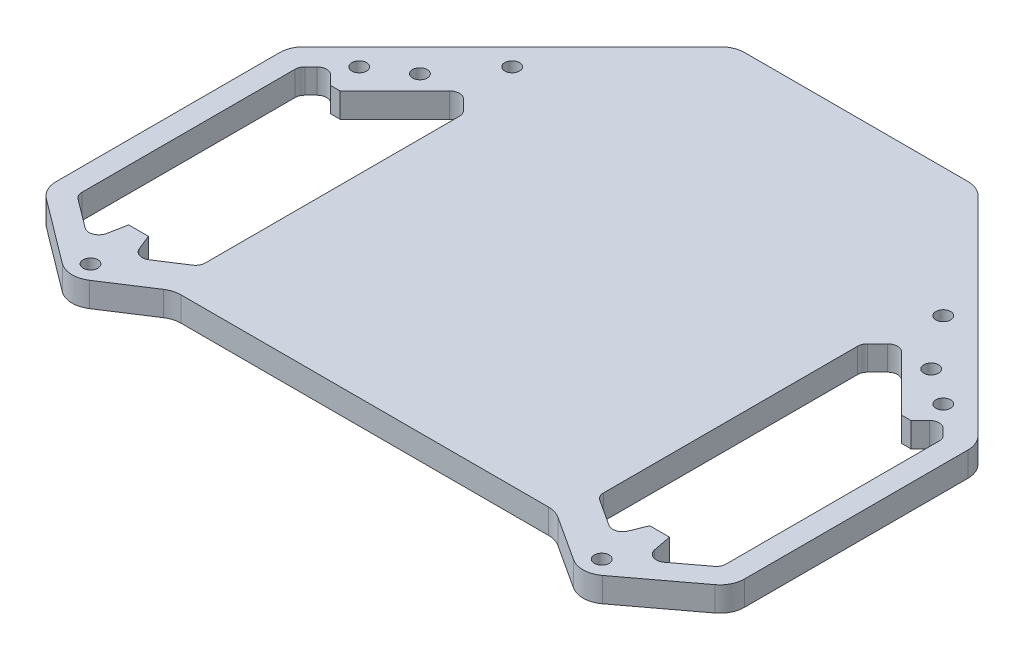
from build123d import *

# Parameters (mm, degrees)
SKETCH1_R            = 1.5
BOSS_EXTRUDE1_DEPTH  = 5
FILLET1_R            = 2
FILLET1_OF_MIRROR1_R = 2
SKETCH2_W            = 70
SKETCH2_H            = 97
CUT_EXTRUDE1_DEPTH   = 3
FILLET2_R            = 5


with BuildPart() as part:
    # Sketch1 → Boss-Extrude1 (new body)
    with BuildSketch(Plane(origin=(0, 0, 0), x_dir=(1, 0, 0), z_dir=(0, 1, 0))):
        Polygon((-52.164149312, -38.645247828), (-70, -25.247940817), (-70, 24.752308679), (-24.752308679, 70), (0, 70), (0, -30), (-38.851635079, -30), align=None)
        with Locations((-43.840620434, 43.840620434)):
            Circle(SKETCH1_R, mode=Mode.SUBTRACT)
        with Locations((-51.997575213, -33.767620171)):
            Circle(SKETCH1_R, mode=Mode.SUBTRACT)
        with Locations((-59.39696962, 28.284271247)):
            Circle(SKETCH1_R, mode=Mode.SUBTRACT)
        with Locations((-51.997575213, 33.232379829)):
            Circle(SKETCH1_R, mode=Mode.SUBTRACT)
        Polygon((-59.003765723, 22.1), (-57.095959493, 22.1), (-44.547727215, 34.648232278), (-40.5, 30.600505063), (-40.5, -23), (-48.796166422, -28.387593469), (-51, -23), (-55, -23), (-56.33662338, -29.883022962), (-65.5, -23), (-65.5, 22.181240867), (-62.292503295, 25.388737572), align=None, mode=Mode.SUBTRACT)
    boss_extrude1 = extrude(amount=BOSS_EXTRUDE1_DEPTH)

    # Fillet1
    fillet1_edges = [part.edges().sort_by_distance(p)[0] for p in [
        (-40.5, 2.5, 23),
        (-48.796166422, 2.5, 28.387593469),
        (-56.33662338, 2.5, 29.883022962),
        (-65.5, 2.5, 23),
        (-65.5, 2.5, -22.181240867),
        (-62.292503295, 2.5, -25.388737572),
        (-40.5, 2.5, -30.600505063),
        (-44.547727215, 2.5, -34.648232278),
    ]]
    fillet(fillet1_edges, radius=FILLET1_R)

    # Mirror1: Boss-Extrude1 across plane
    add(boss_extrude1.mirror(Plane(origin=(0, 5, 30), x_dir=(0, 0, 1), z_dir=(-1, 0, 0))))

    # Fillet1 of Mirror1
    fillet1_of_mirror1_edges = [part.edges().sort_by_distance(p)[0] for p in [
        (40.5, 2.5, 23),
        (48.796166422, 2.5, 28.387593469),
        (56.33662338, 2.5, 29.883022962),
        (65.5, 2.5, 23),
        (65.5, 2.5, -22.181240867),
        (62.292503295, 2.5, -25.388737572),
        (40.5, 2.5, -30.600505063),
        (44.547727215, 2.5, -34.648232278),
    ]]
    fillet(fillet1_of_mirror1_edges, radius=FILLET1_OF_MIRROR1_R)

    # Sketch2 → Cut-Extrude1 (cut)
    with BuildSketch(Plane(origin=(0, 0, 0), x_dir=(1, 0, 0), z_dir=(0, 1, 0))):
        with Locations((0, 21.5)):
            Rectangle(SKETCH2_W, SKETCH2_H)
    extrude(amount=CUT_EXTRUDE1_DEPTH, mode=Mode.SUBTRACT)

    # Fillet2
    fillet2_edges = [part.edges().sort_by_distance(p)[0] for p in [
        (-70, 2.5, 25.247940817),
        (-70, 2.5, -24.752308679),
        (-24.752308679, 4, -70),
        (24.752308679, 4, -70),
        (70, 2.5, -24.752308679),
        (70, 2.5, 25.247940817),
        (38.851635079, 2.5, 30),
        (52.164149312, 2.5, 38.645247828),
        (-38.851635079, 2.5, 30),
        (-52.164149312, 2.5, 38.645247828),
    ]]
    fillet(fillet2_edges, radius=FILLET2_R)


solid = part.part
